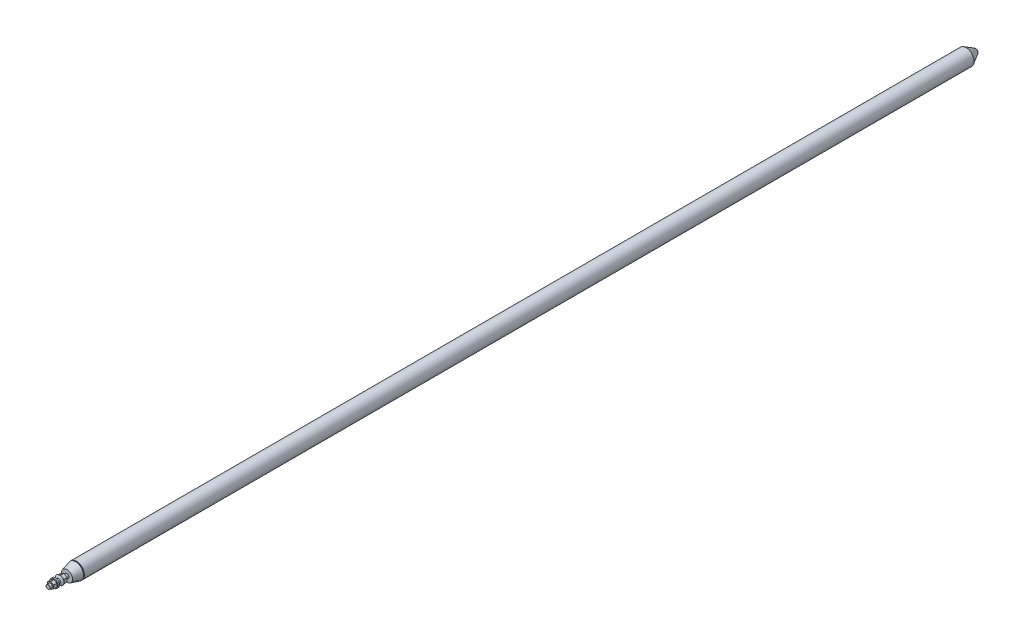
from build123d import *

# Parameters (mm, degrees)
BOSS_REVOLVE3_START         = 12.690475
BOSS_REVOLVE3_OUTLINE_R     = 7.9375
BOSS_REVOLVE3_DEPTH         = 15.478125
BOSS_REVOLVE3_START_2       = 46.292398399
BOSS_REVOLVE3_2_OUTLINE_R   = 16.6751
BOSS_REVOLVE3_2_OUTLINE_R_2 = 7.9375
BOSS_REVOLVE3_2_DEPTH       = 5.8166
BOSS_EXTRUDE2_DEPTH         = 13.890625


# Read off the part's stored shape, not the designer's step: Boss-Revolve3
with BuildPart() as part:
    # Sketch1 → Base-Revolve (revolve)
    with BuildSketch(Plane(origin=(0, 0, 0), x_dir=(0, 0, -1), z_dir=(1, 0, 0)), mode=Mode.PRIVATE) as base_revolve_sk:
        Polygon((-76.2, 0), (-76.2, 7.9375), (0, 7.9375), (0, 22.225), (34.895210283, 31.75), (38.1, 28.575), (47.625, 28.575), (47.625, 0), align=None)
    revolve(base_revolve_sk.sketch.rotate(Axis((0, 0, 0), (0, 0, 1)), 90), axis=Axis((0, 0, 0), (0, 0, 1)))

    # Sketch3 → Boss-Revolve2 (revolve)
    with BuildSketch(Plane(origin=(0, 0, 0), x_dir=(0, 0, -1), z_dir=(1, 0, 0)), mode=Mode.PRIVATE) as boss_revolve2_sk:
        with BuildLine():
            Line((-28.1686, 0), (-28.1686, 17.4625))
            Line((-28.1686, 17.4625), (-29.7688, 17.4625))
            ThreePointArc((-29.7688, 17.4625), (-33.309963658, 9.048473715), (-34.5186, 0))
            Line((-34.5186, 0), (-28.1686, 0))
        make_face()
    revolve(boss_revolve2_sk.sketch.rotate(Axis((0, 0, 0), (0, 0, 1)), 90), axis=Axis((0, 0, 0), (0, 0, 1)))

    # Sketch2 → Boss-Revolve1 (revolve)
    with BuildSketch(Plane(origin=(0, 0, 0), x_dir=(0, 0, -1), z_dir=(1, 0, 0)), mode=Mode.PRIVATE) as boss_revolve1_sk:
        with BuildLine():
            Line((38.1, 31.75), (38.1, 28.5623))
            Line((38.1, 28.5623), (3603.43540845, 28.5623))
            Line((3603.43540845, 28.5623), (3603.43540845, 0))
            Line((3603.43540845, 0), (3645.72802159, 0))
            ThreePointArc((3645.72802159, 0), (3644.026544218, 6.35), (3639.37802159, 10.998522628))
            Line((3639.37802159, 10.998522628), (3603.43540845, 31.75))
            Line((3603.43540845, 31.75), (38.1, 31.75))
        make_face()
    revolve(boss_revolve1_sk.sketch.rotate(Axis((0, 0, 29.7434), (0, 0, -1)), 90), axis=Axis((0, 0, 29.7434), (0, 0, -1)))

    # Boss-Revolve3 outline → Boss-Revolve3 (add)
    with BuildSketch(Plane.XY.offset(BOSS_REVOLVE3_START)):
        Polygon((0, -15.588572738), (13.5001, -7.794286369), (13.5001, 7.794286369), (0, 15.588572738), (-13.5001, 7.794286369), (-13.5001, -7.794286369), align=None)
        Circle(BOSS_REVOLVE3_OUTLINE_R, mode=Mode.SUBTRACT)
    extrude(amount=BOSS_REVOLVE3_DEPTH)

    # Boss-Revolve3 2 outline → Boss-Revolve3 2 (add)
    with BuildSketch(Plane.XY.offset(BOSS_REVOLVE3_START_2)):
        Circle(BOSS_REVOLVE3_2_OUTLINE_R)
        Circle(BOSS_REVOLVE3_2_OUTLINE_R_2, mode=Mode.SUBTRACT)
    extrude(amount=BOSS_REVOLVE3_2_DEPTH)

    # Sketch6 → Boss-Extrude2 (add)
    with BuildSketch(Plane.XY.offset(52.108998399)):
        Polygon((0, -13.755485633), (11.9126, -6.877742817), (11.9126, 6.877742817), (0, 13.755485633), (-11.9126, 6.877742817), (-11.9126, -6.877742817), align=None)
    extrude(amount=BOSS_EXTRUDE2_DEPTH)


solid = part.part
